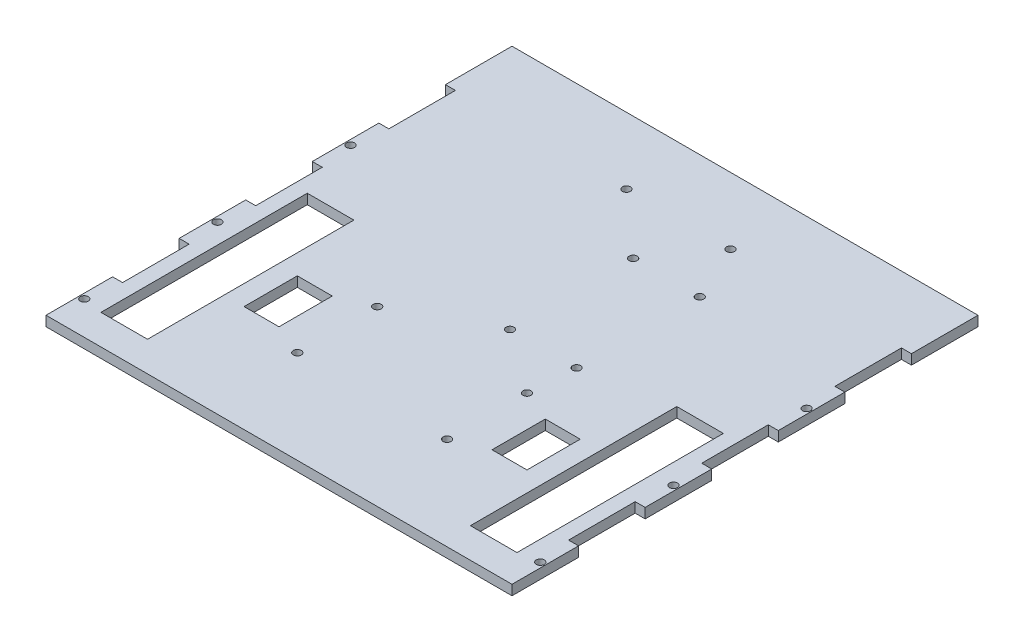
from build123d import *

# Parameters (mm, degrees)
SKETCH1_R           = 1.524
SKETCH1_W           = 13.335
SKETCH1_H           = 20.32
SKETCH1_W_2         = 17.78
SKETCH1_H_2         = 78.74
BOSS_EXTRUDE1_DEPTH = 3.81


with BuildPart() as part:
    # Sketch1 → Boss-Extrude1 (new body)
    with BuildSketch(Plane(origin=(0, 0, 0), x_dir=(1, 0, 0), z_dir=(0, 1, 0))):
        Polygon((-88.9, -88.9), (88.9, -88.9), (88.9, -63.5), (85.09, -63.5), (85.09, -38.1), (88.9, -38.1), (88.9, -12.7), (85.09, -12.7), (85.09, 12.7), (88.9, 12.7), (88.9, 38.1), (85.09, 38.1), (85.09, 63.5), (88.9, 63.5), (88.9, 88.9), (-88.9, 88.9), (-88.9, 63.5), (-85.09, 63.5), (-85.09, 38.1), (-88.9, 38.1), (-88.9, 12.7), (-85.09, 12.7), (-85.09, -12.7), (-88.9, -12.7), (-88.9, -38.1), (-85.09, -38.1), (-85.09, -63.5), (-88.9, -63.5), align=None)
        with Locations((-28.575, -22.86)):
            Circle(SKETCH1_R, mode=Mode.SUBTRACT)
        with Locations((-28.575, -53.34)):
            Circle(SKETCH1_R, mode=Mode.SUBTRACT)
        with Locations((28.575, -53.34)):
            Circle(SKETCH1_R, mode=Mode.SUBTRACT)
        with Locations((28.575, -22.86)):
            Circle(SKETCH1_R, mode=Mode.SUBTRACT)
        with Locations((4.318, 41.91)):
            Circle(SKETCH1_R, mode=Mode.SUBTRACT)
        with Locations((4.318, -5.08)):
            Circle(SKETCH1_R, mode=Mode.SUBTRACT)
        with Locations((29.718, -5.08)):
            Circle(SKETCH1_R, mode=Mode.SUBTRACT)
        with Locations((29.718, 41.91)):
            Circle(SKETCH1_R, mode=Mode.SUBTRACT)
        with Locations((86.995, -76.2)):
            Circle(SKETCH1_R, mode=Mode.SUBTRACT)
        with Locations((-86.995, -76.2)):
            Circle(SKETCH1_R, mode=Mode.SUBTRACT)
        with Locations((-86.995, -25.4)):
            Circle(SKETCH1_R, mode=Mode.SUBTRACT)
        with Locations((-86.995, 25.4)):
            Circle(SKETCH1_R, mode=Mode.SUBTRACT)
        with Locations((86.995, -25.4)):
            Circle(SKETCH1_R, mode=Mode.SUBTRACT)
        with Locations((86.995, 25.4)):
            Circle(SKETCH1_R, mode=Mode.SUBTRACT)
        with Locations((-19.8501, 63.5)):
            Circle(SKETCH1_R, mode=Mode.SUBTRACT)
        with Locations((19.8501, 63.5)):
            Circle(SKETCH1_R, mode=Mode.SUBTRACT)
        with Locations((-47.3075, -38.1)):
            Rectangle(SKETCH1_W, SKETCH1_H, mode=Mode.SUBTRACT)
        with Locations((70.485, -38.1)):
            Rectangle(SKETCH1_W_2, SKETCH1_H_2, mode=Mode.SUBTRACT)
        with Locations((-70.485, -38.1)):
            Rectangle(SKETCH1_W_2, SKETCH1_H_2, mode=Mode.SUBTRACT)
        with Locations((47.3075, -38.1)):
            Rectangle(SKETCH1_W, SKETCH1_H, mode=Mode.SUBTRACT)
    extrude(amount=BOSS_EXTRUDE1_DEPTH)


solid = part.part
